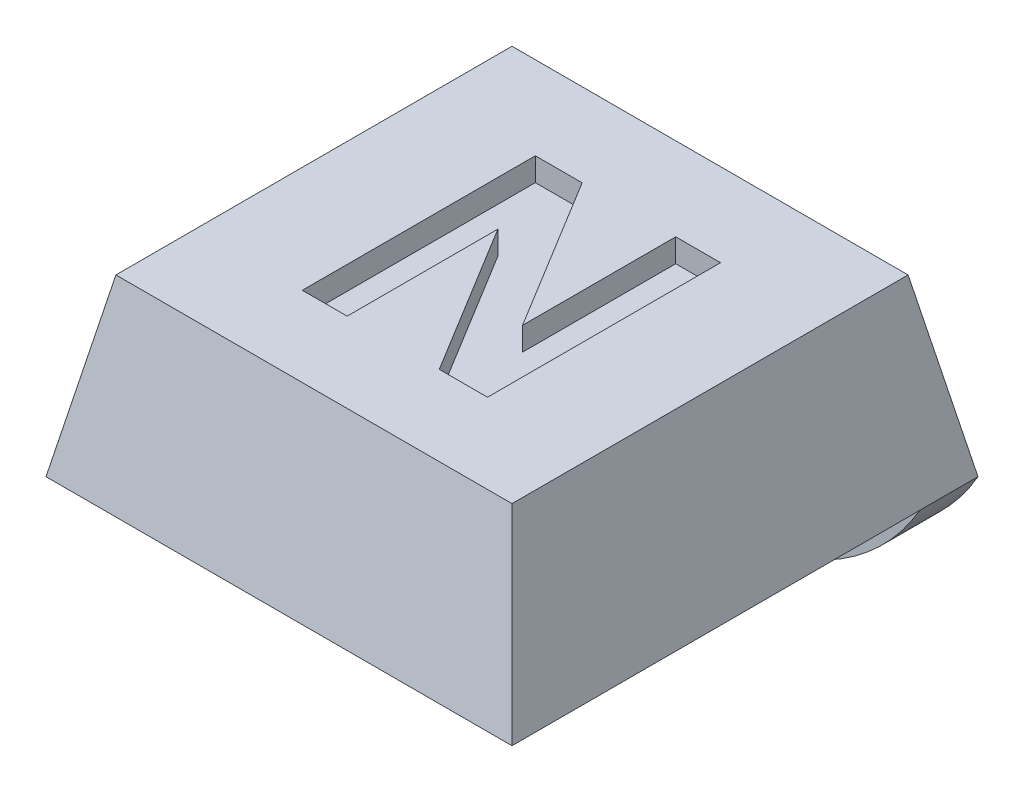
from build123d import *

# Parameters (mm, degrees)
SKETCH1_W               = 8
SKETCH1_H               = 8
BOSS_EXTRUDE1_DEPTH     = 3
CUT_EXTRUDE1_DEPTH      = 12.704699911
CUT_EXTRUDE1_DEPTH_BACK = 12.704699911
CUT_EXTRUDE2_DEPTH      = 11
SKETCH4_R               = 1.75
CUT_EXTRUDE3_DEPTH      = 0.4
SKETCH5_W               = 8
SKETCH5_H               = 1
BOSS_EXTRUDE2_DEPTH     = 2
FILLET1_R               = 4
CUT_EXTRUDE4_DEPTH      = 0.4


with BuildPart() as part:
    # Sketch1 → Boss-Extrude1 (new body)
    with BuildSketch(Plane(origin=(0, 0, 0), x_dir=(1, 0, 0), z_dir=(0, 1, 0))):
        with Locations((4, 4)):
            Rectangle(SKETCH1_W, SKETCH1_H)
    extrude(amount=BOSS_EXTRUDE1_DEPTH)

    # Sketch2 → Cut-Extrude1 (cut, two sides: drawn at the far end of the back side and taken through both)
    with BuildSketch(Plane.XY.offset(-CUT_EXTRUDE1_DEPTH_BACK)):
        Polygon((0, 0), (0.6, 3), (0, 3), align=None)
        Polygon((8, 0), (7.4, 3), (8, 3), align=None)
    extrude(amount=CUT_EXTRUDE1_DEPTH + CUT_EXTRUDE1_DEPTH_BACK, mode=Mode.SUBTRACT)

    # Sketch3 → Cut-Extrude2 (cut)
    with BuildSketch(Plane(origin=(0, 0, 0), x_dir=(0, 0, -1), z_dir=(1, 0, 0))):
        Polygon((0, 0), (0.6, 3), (0, 3), align=None)
        Polygon((8, 3), (7.4, 3), (8, 0), align=None)
    extrude(amount=CUT_EXTRUDE2_DEPTH, mode=Mode.SUBTRACT)

    # Sketch4 → Cut-Extrude3 (cut)
    with BuildSketch(Plane.XZ):
        with Locations(Location((4, -3.75, 0), (0, 0, 270))):
            Circle(SKETCH4_R)
    extrude(amount=-CUT_EXTRUDE3_DEPTH, mode=Mode.SUBTRACT)

    # Sketch5 → Boss-Extrude2 (add)
    with BuildSketch(Plane.XZ):
        with Locations((4, -7.5)):
            Rectangle(SKETCH5_W, SKETCH5_H)
    extrude(amount=BOSS_EXTRUDE2_DEPTH)

    # Fillet1
    # the kernel refuses this fillet: 4 mm, written as the material it takes off along each edge
    with BuildSketch(Plane(origin=(8, -2, -16.660254038), x_dir=(0, 1, 0), z_dir=(0, 0, 1)), Plane(origin=(0, -2, 1.660254038), x_dir=(0, 1, 0), z_dir=(0, 0, -1))) as fillet1_piece_1:
        with BuildLine():
            CenterArc((4, 3.464101615), FILLET1_R, 180, 60)
            Line((0, 3.464101615), (-0.08, 3.464101615))
            Line((-0.08, 3.464101615), (-0.08, 0))
            Line((-0.08, 0), (0, -0.08))
            ThreePointArc((0, -0.08), (1, -0.08), (1.96, -0.069282032))
            Line((1.96, -0.069282032), (2, 0))
        make_face()
    extrude(amount=18.320508076, mode=Mode.SUBTRACT)

    # Sketch6 → Cut-Extrude4 (cut)
    with BuildSketch(Plane(origin=(0, 3, 0), x_dir=(1, 0, 0), z_dir=(0, 1, 0))):
        Polygon((2.428562008, 1.972012859), (2.428562008, 5.972012859), (3.232247906, 5.972012859), (4.838818418, 3.342205167), (4.838818418, 5.972012859), (5.608049188, 5.972012859), (5.608049188, 1.972012859), (4.779523547, 1.972012859), (3.197792777, 4.560153885), (3.197792777, 1.972012859), align=None)
    extrude(amount=-CUT_EXTRUDE4_DEPTH, mode=Mode.SUBTRACT)


solid = part.part
